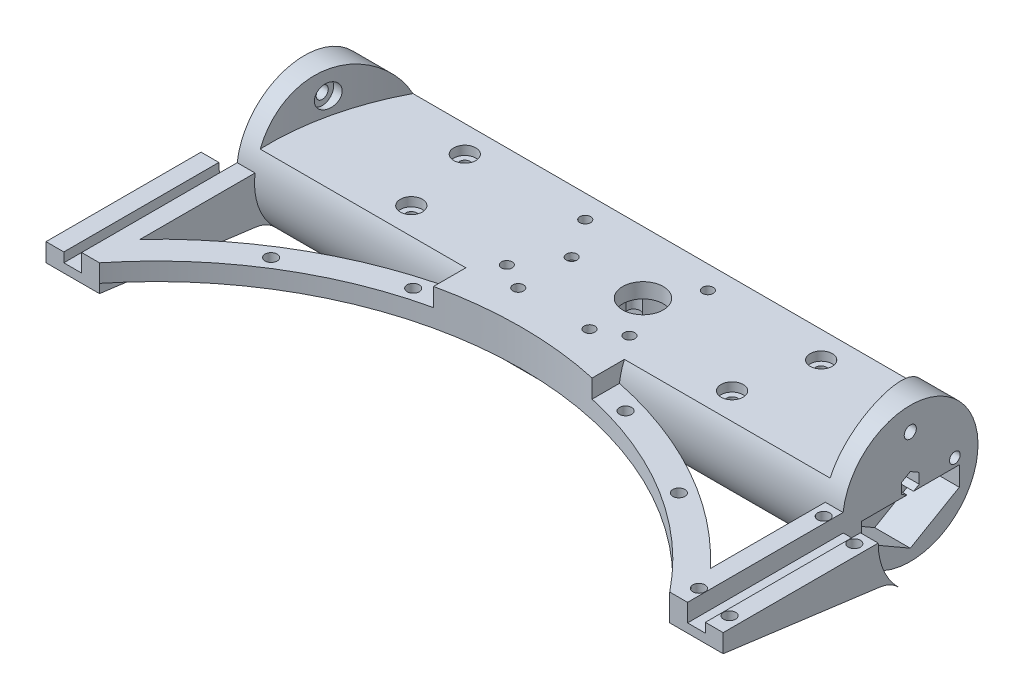
from build123d import *

# Parameters (mm, degrees)
SKETCH1_R                = 24.13
BOSS_EXTRUDE1_DEPTH      = 107.95
CUT_EXTRUDE1_DEPTH       = 12.7
BOSS_EXTRUDE2_DEPTH      = 6.35
BOSS_EXTRUDE3_START      = 12.7
BOSS_EXTRUDE3_DEPTH      = 12.7
SKETCH5_W                = 6.35
SKETCH5_H                = 6.35
CUT_EXTRUDE2_DEPTH       = 161.785460863
CUT_EXTRUDE3_DEPTH       = 147.420866085
CUT_EXTRUDE3_DEPTH_BACK  = 147.420866085
SKETCH6_W                = 165.1
SKETCH6_H                = 14.605
CAVITY1_START            = -24.1300001
CAVITY1_DEPTH            = 18.1610001
CAVITY1_START_2          = -5.969
CAVITY1_2_OUTLINE_R      = 1.143
CAVITY1_2_OUTLINE_R_2    = 4.445
CAVITY1_2_DEPTH          = 10.16
CAVITY1_START_3          = 4.191
CAVITY1_3_OUTLINE_R      = 1.143
CAVITY1_3_OUTLINE_R_2    = 7.239
CAVITY1_3_DEPTH          = 5.334
CAVITY1_4_OUTLINE_R      = 4.445
CAVITY1_4_DEPTH          = 3.048
CAVITY1_5_DEPTH          = 1.778
CAVITY1_START_4          = 6.223
CAVITY1_6_OUTLINE_R      = 1.905
CAVITY1_6_OUTLINE_R_2    = 1.143
CAVITY1_6_DEPTH          = 3.302
CAVITY1_7_OUTLINE_R      = 2.286
CAVITY1_7_DEPTH          = 1.27
CAVITY1_START_5          = 7.239
CAVITY1_8_DEPTH          = 0.254
CUT_EXTRUDE4_DEPTH       = 148.786424587
CUT_EXTRUDE4_DEPTH_BACK  = 148.786424587
SKETCH8_R                = 1.905
CUT_EXTRUDE7_DEPTH       = 31.75
SKETCH13_R               = 1.905
CUT_EXTRUDE8_DEPTH       = 12.7
SKETCH19_R               = 1.905
CUT_EXTRUDE12_DEPTH      = 9.525
CUT_EXTRUDE6_DEPTH       = 147.944540934
CUT_EXTRUDE6_DEPTH_BACK  = 147.944540934
SKETCH11_R               = 2.159
SKETCH14_R               = 1.905
CUT_EXTRUDE9_DEPTH       = 25.4
SKETCH15_R               = 3.937
CUT_EXTRUDE10_DEPTH      = 3.175
CUT_EXTRUDE13_DEPTH      = 27.305
CUT_EXTRUDE14_START      = -6.35
SKETCH21_R               = 4.064
CUT_EXTRUDE14_DEPTH      = 6.35
SKETCH22_R               = 2.159
CUT_EXTRUDE15_DEPTH      = 226.374910033
BOSS_EXTRUDE4_DEPTH      = 6.35
CUT_EXTRUDE11_DEPTH      = 147.944540934
CUT_EXTRUDE11_DEPTH_BACK = 147.944540934
SKETCH16_R               = 2.159
BOSS_EXTRUDE5_DEPTH      = 6.5278


# Read off the part's stored shape, not the designer's step: Cavity1
with BuildPart() as part:
    # Sketch1 → Boss-Extrude1 (new, symmetric)
    with BuildSketch(Plane(origin=(0, 0, 0), x_dir=(0, 0, -1), z_dir=(1, 0, 0))):
        Circle(SKETCH1_R)
    extrude(amount=BOSS_EXTRUDE1_DEPTH, both=True)

    # Sketch2 → Cut-Extrude1 (cut)
    with BuildSketch(Plane(origin=(107.95, 0, 0), x_dir=(0, 0, -1), z_dir=(1, 0, 0))):
        Polygon((-17.4625, -9.904179076), (0, -19.986158151), (17.4625, -9.904179076), (17.4625, -2.9972), (-17.4625, -2.9972), align=None)
    cut_extrude1 = extrude(amount=-CUT_EXTRUDE1_DEPTH, mode=Mode.SUBTRACT)

    # Sketch3 → Boss-Extrude2 (add)
    with BuildSketch(Plane(origin=(107.95, 0, 0), x_dir=(0, 0, -1), z_dir=(1, 0, 0))):
        with BuildLine():
            Line((-23.943134552, 2.9972), (-79.375, 2.9972))
            Line((-79.375, 2.9972), (-79.375, -6.5278))
            Line((-79.375, -6.5278), (-23.510990682, -13.882436352))
            ThreePointArc((-23.510990682, -13.882436352), (-20.024224443, -14.940135327), (-17.06248663, -17.06248663))
            ThreePointArc((-17.06248663, -17.06248663), (-22.824613886, -7.829042148), (-23.943134552, 2.9972))
        make_face()
    boss_extrude2 = extrude(amount=-BOSS_EXTRUDE2_DEPTH)

    # Sketch4 → Boss-Extrude3 (add)
    with BuildSketch(Plane(origin=(107.95, 0, 0), x_dir=(0, 0, -1), z_dir=(1, 0, 0)).offset(BOSS_EXTRUDE3_START)):
        with BuildLine():
            Line((-24.13, 0), (-79.375, 0))
            Line((-79.375, 0), (-79.375, -6.5278))
            Line((-79.375, -6.5278), (-23.510990682, -13.882436352))
            ThreePointArc((-23.510990682, -13.882436352), (-20.024224443, -14.940135327), (-17.06248663, -17.06248663))
            ThreePointArc((-17.06248663, -17.06248663), (-22.293213119, -9.234151223), (-24.13, 0))
        make_face()
    boss_extrude3 = extrude(amount=-BOSS_EXTRUDE3_DEPTH)

    # Sketch5 → Cut-Extrude2 (cut, through all)
    with BuildSketch(Plane.XY.offset(79.375)):
        with Locations((111.125, -0.1778)):
            Rectangle(SKETCH5_W, SKETCH5_H)
    cut_extrude2 = extrude(amount=-CUT_EXTRUDE2_DEPTH, mode=Mode.SUBTRACT)

    # Sketch6 → Cut-Extrude3 (cut, two sides: drawn at the far end of the back side and taken through both)
    with BuildSketch(Plane.XY.offset(-CUT_EXTRUDE3_DEPTH_BACK)):
        with Locations((0, 16.8275)):
            Rectangle(SKETCH6_W, SKETCH6_H)
    extrude(amount=CUT_EXTRUDE3_DEPTH + CUT_EXTRUDE3_DEPTH_BACK, mode=Mode.SUBTRACT)

    # Cavity1 outline → Cavity1 (cut)
    with BuildSketch(Plane(origin=(0, 0, 0), x_dir=(1, 0, 0), z_dir=(0, 1, 0)).offset(CAVITY1_START)):
        with BuildLine():
            ThreePointArc((25.654, -16.8275), (28.168471714, -15.785971714), (29.21, -13.2715))
            Line((29.21, -13.2715), (29.21, 13.2715))
            ThreePointArc((29.21, 13.2715), (28.168471714, 15.785971714), (25.654, 16.8275))
            Line((25.654, 16.8275), (-25.654, 16.8275))
            ThreePointArc((-25.654, 16.8275), (-28.168471714, 15.785971714), (-29.21, 13.2715))
            Line((-29.21, 13.2715), (-29.21, -13.2715))
            ThreePointArc((-29.21, -13.2715), (-28.168471714, -15.785971714), (-25.654, -16.8275))
            Line((-25.654, -16.8275), (25.654, -16.8275))
        make_face()
    extrude(amount=CAVITY1_DEPTH, mode=Mode.SUBTRACT)

    # Cavity1 2 outline → Cavity1 2 (cut)
    with BuildSketch(Plane(origin=(0, 0, 0), x_dir=(1, 0, 0), z_dir=(0, 1, 0)).offset(CAVITY1_START_2)):
        with BuildLine():
            ThreePointArc((25.410188518, -6.663505747), (27.051, 0), (25.410188518, 6.663505747))
            ThreePointArc((25.410188518, 6.663505747), (26.739105214, 10.236847552), (22.930567504, 10.064128852))
            ThreePointArc((22.930567504, 10.064128852), (12.7, 14.351), (2.469432496, 10.064128852))
            ThreePointArc((2.469432496, 10.064128852), (-1.339105214, 10.236847552), (-0.010188518, 6.663505747))
            ThreePointArc((-0.010188518, 6.663505747), (-1.651, 0), (-0.010188518, -6.663505747))
            ThreePointArc((-0.010188518, -6.663505747), (-1.339105214, -10.236847552), (2.469432496, -10.064128852))
            ThreePointArc((2.469432496, -10.064128852), (12.7, -14.351), (22.930567504, -10.064128852))
            ThreePointArc((22.930567504, -10.064128852), (26.739105214, -10.236847552), (25.410188518, -6.663505747))
        make_face()
        with Locations((21.844, -13.97)):
            Circle(CAVITY1_2_OUTLINE_R)
        with Locations((-21.844, -13.97)):
            Circle(CAVITY1_2_OUTLINE_R)
        with Locations((-12.7, 0)):
            Circle(CAVITY1_2_OUTLINE_R_2)
        with Locations((21.844, 13.97)):
            Circle(CAVITY1_2_OUTLINE_R)
        with Locations((-21.844, 13.97)):
            Circle(CAVITY1_2_OUTLINE_R)
    extrude(amount=CAVITY1_2_DEPTH, mode=Mode.SUBTRACT)

    # Cavity1 3 outline → Cavity1 3 (cut)
    with BuildSketch(Plane(origin=(0, 0, 0), x_dir=(1, 0, 0), z_dir=(0, 1, 0)).offset(CAVITY1_START_3)):
        with Locations((21.844, -13.97)):
            Circle(CAVITY1_3_OUTLINE_R)
        with Locations((-21.844, -13.97)):
            Circle(CAVITY1_3_OUTLINE_R)
        with Locations((21.844, 13.97)):
            Circle(CAVITY1_3_OUTLINE_R)
        with Locations((-21.844, 13.97)):
            Circle(CAVITY1_3_OUTLINE_R)
        with Locations((12.7, 0)):
            Circle(CAVITY1_3_OUTLINE_R_2)
    extrude(amount=CAVITY1_3_DEPTH, mode=Mode.SUBTRACT)

    # Cavity1 4 outline → Cavity1 4 (cut)
    with BuildSketch(Plane(origin=(0, 0, 0), x_dir=(1, 0, 0), z_dir=(0, 1, 0)).offset(CAVITY1_START_3)):
        with BuildLine():
            ThreePointArc((-1.186815, 3.62043784), (-1.651, 0), (-1.186815, -3.62043784))
            ThreePointArc((-1.186815, -3.62043784), (3.81, 0), (-1.186815, 3.62043784))
        make_face()
        with Locations((-12.7, 0)):
            Circle(CAVITY1_4_OUTLINE_R)
    extrude(amount=CAVITY1_4_DEPTH, mode=Mode.SUBTRACT)

    # Cavity1 5 outline → Cavity1 5 (cut)
    with BuildSketch(Plane(origin=(0, 0, 0), x_dir=(1, 0, 0), z_dir=(0, 1, 0)).offset(CAVITY1_START_2)):
        with BuildLine():
            Line((-11.689058668, -4.32851275), (-13.598725967, -6.269761763))
            ThreePointArc((-13.598725967, -6.269761763), (-10.20766679, -4.581043619), (-8.381648336, -1.261900971))
            Line((-8.381648336, -1.261900971), (-8.432941907, -1.245086436))
            ThreePointArc((-8.432941907, -1.245086436), (-9.643662496, -3.227510815), (-11.689058668, -4.32851275))
        make_face()
        with BuildLine():
            ThreePointArc((-20.367669641, -2.667234262), (-17.588349777, -5.605544051), (-13.598725967, -6.269761763))
            Line((-13.598725967, -6.269761763), (-11.689058668, -4.32851275))
            ThreePointArc((-11.689058668, -4.32851275), (-14.8148806, -3.909642573), (-16.876068942, -1.522653339))
            Line((-16.876068942, -1.522653339), (-20.367669641, -2.667234262))
        make_face()
        with BuildLine():
            Line((-8.432941907, -1.245086436), (-8.381648336, -1.261900971))
            ThreePointArc((-8.381648336, -1.261900971), (-8.34804351, -1.083049158), (-8.319577582, -0.903307825))
            Line((-8.319577582, -0.903307825), (-8.355488936, -0.939813075))
            ThreePointArc((-8.355488936, -0.939813075), (-8.391510846, -1.093135951), (-8.432941907, -1.245086436))
        make_face()
        with BuildLine():
            ThreePointArc((-20.367669641, 2.667234262), (-20.955, 0), (-20.367669641, -2.667234262))
            Line((-20.367669641, -2.667234262), (-16.876068942, -1.522653339))
            ThreePointArc((-16.876068942, -1.522653339), (-17.145, 0), (-16.876068942, 1.522653339))
            Line((-16.876068942, 1.522653339), (-20.367669641, 2.667234262))
        make_face()
        with BuildLine():
            Line((-8.355488936, 0.939813075), (-8.319577582, 0.903307825))
            ThreePointArc((-8.319577582, 0.903307825), (-8.34804351, 1.083049158), (-8.381648336, 1.261900971))
            Line((-8.381648336, 1.261900971), (-8.432941907, 1.245086436))
            ThreePointArc((-8.432941907, 1.245086436), (-8.391510846, 1.093135951), (-8.355488936, 0.939813075))
        make_face()
        with BuildLine():
            ThreePointArc((-8.255, 0), (-8.271164971, 0.452806607), (-8.319577582, 0.903307825))
            Line((-8.319577582, 0.903307825), (-8.355488936, 0.939813075))
            ThreePointArc((-8.355488936, 0.939813075), (-8.280193631, 0.472585083), (-8.255, 0))
        make_face()
        with BuildLine():
            Line((-8.355488936, -0.939813075), (-8.319577582, -0.903307825))
            ThreePointArc((-8.319577582, -0.903307825), (-8.271164971, -0.452806607), (-8.255, 0))
            ThreePointArc((-8.255, 0), (-8.280193631, -0.472585083), (-8.355488936, -0.939813075))
        make_face()
        with BuildLine():
            ThreePointArc((-13.598725967, 6.269761763), (-17.588349777, 5.605544051), (-20.367669641, 2.667234262))
            Line((-20.367669641, 2.667234262), (-16.876068942, 1.522653339))
            ThreePointArc((-16.876068942, 1.522653339), (-14.8148806, 3.909642573), (-11.689058668, 4.32851275))
            Line((-11.689058668, 4.32851275), (-13.598725967, 6.269761763))
        make_face()
        with BuildLine():
            Line((-8.432941907, 1.245086436), (-8.381648336, 1.261900971))
            ThreePointArc((-8.381648336, 1.261900971), (-10.20766679, 4.581043619), (-13.598725967, 6.269761763))
            Line((-13.598725967, 6.269761763), (-11.689058668, 4.32851275))
            ThreePointArc((-11.689058668, 4.32851275), (-9.643662496, 3.227510815), (-8.432941907, 1.245086436))
        make_face()
    extrude(amount=CAVITY1_5_DEPTH, mode=Mode.SUBTRACT)

    # Cavity1 6 outline → Cavity1 6 (cut)
    # profile 1 of 4: a face of its own
    with BuildSketch(Plane(origin=(0, 0, 0), x_dir=(1, 0, 0), z_dir=(0, 1, 0)).offset(CAVITY1_START_4)):
        with Locations((21.844, -13.97)):
            Circle(CAVITY1_6_OUTLINE_R)
        with Locations((21.844, -13.97)):
            Circle(CAVITY1_6_OUTLINE_R_2, mode=Mode.SUBTRACT)
    # profile 2 of 4: a face of its own
    with BuildSketch(Plane(origin=(0, 0, 0), x_dir=(1, 0, 0), z_dir=(0, 1, 0)).offset(CAVITY1_START_4)):
        with Locations((-21.844, -13.97)):
            Circle(CAVITY1_6_OUTLINE_R)
        with Locations((-21.844, -13.97)):
            Circle(CAVITY1_6_OUTLINE_R_2, mode=Mode.SUBTRACT)
    # profile 3 of 4: a face of its own
    with BuildSketch(Plane(origin=(0, 0, 0), x_dir=(1, 0, 0), z_dir=(0, 1, 0)).offset(CAVITY1_START_4)):
        with Locations((21.844, 13.97)):
            Circle(CAVITY1_6_OUTLINE_R)
        with Locations((21.844, 13.97)):
            Circle(CAVITY1_6_OUTLINE_R_2, mode=Mode.SUBTRACT)
    # profile 4 of 4: a face of its own
    with BuildSketch(Plane(origin=(0, 0, 0), x_dir=(1, 0, 0), z_dir=(0, 1, 0)).offset(CAVITY1_START_4)):
        with Locations((-21.844, 13.97)):
            Circle(CAVITY1_6_OUTLINE_R)
        with Locations((-21.844, 13.97)):
            Circle(CAVITY1_6_OUTLINE_R_2, mode=Mode.SUBTRACT)
    extrude(amount=CAVITY1_6_DEPTH, mode=Mode.SUBTRACT)

    # Cavity1 7 outline → Cavity1 7 (cut)
    with BuildSketch(Plane(origin=(0, 0, 0), x_dir=(1, 0, 0), z_dir=(0, 1, 0)).offset(CAVITY1_START_3)):
        with Locations((24.892, -8.89)):
            Circle(CAVITY1_7_OUTLINE_R)
        with Locations((0.508, -8.89)):
            Circle(CAVITY1_7_OUTLINE_R)
        with Locations((24.892, 8.89)):
            Circle(CAVITY1_7_OUTLINE_R)
        with Locations((0.508, 8.89)):
            Circle(CAVITY1_7_OUTLINE_R)
    extrude(amount=CAVITY1_7_DEPTH, mode=Mode.SUBTRACT)

    # Cavity1 8 outline → Cavity1 8 (cut)
    with BuildSketch(Plane(origin=(0, 0, 0), x_dir=(1, 0, 0), z_dir=(0, 1, 0)).offset(CAVITY1_START_5)):
        with BuildLine():
            ThreePointArc((-1.186815, 3.62043784), (-1.651, 0), (-1.186815, -3.62043784))
            ThreePointArc((-1.186815, -3.62043784), (3.81, 0), (-1.186815, 3.62043784))
        make_face()
    extrude(amount=CAVITY1_8_DEPTH, mode=Mode.SUBTRACT)

    # Sketch8 → Cut-Extrude4 (cut, two sides: drawn at the far end of the back side and taken through both)
    with BuildSketch(Plane.XZ.offset(-7.239).offset(-CUT_EXTRUDE4_DEPTH_BACK)):
        with Locations(Location((-12.7, 0, 0), (0, 0, 270))):
            Circle(SKETCH8_R)
    extrude(amount=CUT_EXTRUDE4_DEPTH + CUT_EXTRUDE4_DEPTH_BACK, mode=Mode.SUBTRACT)

    # Sketch12 → Cut-Extrude7 (cut)
    with BuildSketch(Plane(origin=(107.95, 0, 0), x_dir=(0, 0, -1), z_dir=(1, 0, 0))):
        Polygon((3.175, -1.833087105), (3.175, 1.833087105), (0, 3.666174209), (-3.175, 1.833087105), (-3.175, -1.833087105), (0, -3.666174209), align=None)
    cut_extrude7 = extrude(amount=-CUT_EXTRUDE7_DEPTH, mode=Mode.SUBTRACT)

    # Sketch13 → Cut-Extrude8 (cut)
    with BuildSketch(Plane(origin=(107.95, 0, 0), x_dir=(0, 0, -1), z_dir=(1, 0, 0))):
        with Locations((15.875, 0)):
            Circle(SKETCH13_R)
    cut_extrude8 = extrude(amount=-CUT_EXTRUDE8_DEPTH, mode=Mode.SUBTRACT)

    # Sketch19 → Cut-Extrude12 (cut)
    with BuildSketch(Plane(origin=(0, 9.525, 0), x_dir=(1, 0, 0), z_dir=(0, 1, 0))):
        with Locations(Location((12.7, -19.05, 0), (0, 0, 270))):
            Circle(SKETCH19_R)
        with Locations(Location((-12.7, -19.05, 0), (0, 0, 270))):
            Circle(SKETCH19_R)
    extrude(amount=-CUT_EXTRUDE12_DEPTH, mode=Mode.SUBTRACT)

    # Sketch11 → Cut-Extrude6 (cut, two sides: drawn at the far end of the back side and taken through both)
    with BuildSketch(Plane(origin=(0, 2.9972, 0), x_dir=(1, 0, 0), z_dir=(0, 1, 0)).offset(-CUT_EXTRUDE6_DEPTH_BACK)):
        with Locations(Location((116.586, -28.575, 0), (0, 0, 270))):
            Circle(SKETCH11_R)
        with Locations(Location((116.586, -73.025, 0), (0, 0, 270))):
            Circle(SKETCH11_R)
        with Locations(Location((105.664, -73.025, 0), (0, 0, 270))):
            Circle(SKETCH11_R)
        with Locations(Location((105.664, -28.575, 0), (0, 0, 270))):
            Circle(SKETCH11_R)
    extrude(amount=CUT_EXTRUDE6_DEPTH + CUT_EXTRUDE6_DEPTH_BACK, mode=Mode.SUBTRACT)

    # Sketch14 → Cut-Extrude9 (cut)
    with BuildSketch(Plane(origin=(0, 9.525, 0), x_dir=(1, 0, 0), z_dir=(0, 1, 0))):
        with Locations(Location((63.5, 12.7, 0), (0, 0, 270))):
            Circle(SKETCH14_R)
        with Locations(Location((57.15, -12.7, 0), (0, 0, 270))):
            Circle(SKETCH14_R)
        with Locations(Location((-57.15, -12.7, 0), (0, 0, 90))):
            Circle(SKETCH14_R)
        with Locations(Location((-63.5, 12.7, 0), (0, 0, 90))):
            Circle(SKETCH14_R)
    extrude(amount=-CUT_EXTRUDE9_DEPTH, mode=Mode.SUBTRACT)

    # Sketch15 → Cut-Extrude10 (cut)
    with BuildSketch(Plane(origin=(0, 9.525, 0), x_dir=(1, 0, 0), z_dir=(0, 1, 0))):
        with Locations(Location((63.5, 12.7, 0), (0, 0, 270))):
            Circle(SKETCH15_R)
        with Locations(Location((57.15, -12.7, 0), (0, 0, 270))):
            Circle(SKETCH15_R)
        with Locations(Location((-57.15, -12.7, 0), (0, 0, 270))):
            Circle(SKETCH15_R)
        with Locations(Location((-63.5, 12.7, 0), (0, 0, 270))):
            Circle(SKETCH15_R)
    extrude(amount=-CUT_EXTRUDE10_DEPTH, mode=Mode.SUBTRACT)

    # Sketch20 → Cut-Extrude13 (cut)
    with BuildSketch(Plane(origin=(0, 9.525, 0), x_dir=(1, 0, 0), z_dir=(0, 1, 0))):
        with BuildLine():
            Line((90.409057387, 24.13), (82.55, 24.13))
            Line((82.55, 24.13), (82.55, -24.13))
            Line((82.55, -24.13), (101.454738465, -24.13))
            ThreePointArc((101.454738465, -24.13), (99.359135308, 0.784421283), (90.409057387, 24.13))
        make_face()
    cut_extrude13 = extrude(amount=CUT_EXTRUDE13_DEPTH, mode=Mode.SUBTRACT)

    # Sketch21 → Cut-Extrude14 (cut)
    with BuildSketch(Plane(origin=(107.95, 0, 0), x_dir=(0, 0, -1), z_dir=(1, 0, 0)).offset(CUT_EXTRUDE14_START)):
        with Locations((0, 15.875)):
            Circle(SKETCH21_R)
    cut_extrude14 = extrude(amount=-CUT_EXTRUDE14_DEPTH, mode=Mode.SUBTRACT)

    # Sketch22 → Cut-Extrude15 (cut, through all)
    with BuildSketch(Plane.ZY.offset(-101.6)):
        with Locations((0, 15.875)):
            Circle(SKETCH22_R)
    cut_extrude15 = extrude(amount=-CUT_EXTRUDE15_DEPTH, mode=Mode.SUBTRACT)

    # Mirror2: Cut-Extrude1, Boss-Extrude2, Boss-Extrude3, Cut-Extrude2, Cut-Extrude7, Cut-Extrude8, Cut-Extrude13, Cut-Extrude14, Cut-Extrude15 across plane
    add(cut_extrude1.mirror(Plane(origin=(0, 0, 0), x_dir=(0, 0, 1), z_dir=(1, 0, 0))), mode=Mode.SUBTRACT)
    add(boss_extrude2.mirror(Plane(origin=(0, 0, 0), x_dir=(0, 0, 1), z_dir=(1, 0, 0))))
    add(boss_extrude3.mirror(Plane(origin=(0, 0, 0), x_dir=(0, 0, 1), z_dir=(1, 0, 0))))
    add(cut_extrude2.mirror(Plane(origin=(0, 0, 0), x_dir=(0, 0, 1), z_dir=(1, 0, 0))), mode=Mode.SUBTRACT)
    add(cut_extrude7.mirror(Plane(origin=(0, 0, 0), x_dir=(0, 0, 1), z_dir=(1, 0, 0))), mode=Mode.SUBTRACT)
    add(cut_extrude8.mirror(Plane(origin=(0, 0, 0), x_dir=(0, 0, 1), z_dir=(1, 0, 0))), mode=Mode.SUBTRACT)
    add(cut_extrude13.mirror(Plane(origin=(0, 0, 0), x_dir=(0, 0, 1), z_dir=(1, 0, 0))), mode=Mode.SUBTRACT)
    add(cut_extrude14.mirror(Plane(origin=(0, 0, 0), x_dir=(0, 0, 1), z_dir=(1, 0, 0))), mode=Mode.SUBTRACT)
    add(cut_extrude15.mirror(Plane(origin=(0, 0, 0), x_dir=(0, 0, 1), z_dir=(1, 0, 0))), mode=Mode.SUBTRACT)

    # Sketch7 → Boss-Extrude4 (add)
    with BuildSketch(Plane(origin=(0, 2.9972, 0), x_dir=(1, 0, 0), z_dir=(0, 1, 0))):
        with BuildLine():
            Line((-101.6, -79.375), (-101.6, -64.873738346))
            ThreePointArc((-101.6, -64.873738346), (0, -21.056635674), (101.6, -64.873738346))
            Line((101.6, -64.873738346), (101.6, -79.375))
            ThreePointArc((101.6, -79.375), (0, -30.581635674), (-101.6, -79.375))
        make_face()
    extrude(amount=-BOSS_EXTRUDE4_DEPTH)

    # Sketch16 → Cut-Extrude11 (cut, two sides: drawn at the far end of the back side and taken through both)
    with BuildSketch(Plane(origin=(0, 2.9972, 0), x_dir=(1, 0, 0), z_dir=(0, 1, 0)).offset(-CUT_EXTRUDE11_DEPTH_BACK)):
        with Locations(Location((72.640289503, -47.171306489, 0), (0, 0, 270))):
            Circle(SKETCH16_R)
        with Locations(Location((37.841139766, -31.349190733, 0), (0, 0, 270))):
            Circle(SKETCH16_R)
        with Locations(Location((-37.841139766, -31.349190733, 0), (0, 0, 270))):
            Circle(SKETCH16_R)
        with Locations(Location((-72.640289503, -47.171306489, 0), (0, 0, 270))):
            Circle(SKETCH16_R)
    extrude(amount=CUT_EXTRUDE11_DEPTH + CUT_EXTRUDE11_DEPTH_BACK, mode=Mode.SUBTRACT)

    # Sketch18 → Boss-Extrude5 (add)
    with BuildSketch(Plane(origin=(0, 9.525, 0), x_dir=(1, 0, 0), z_dir=(0, 1, 0))):
        with BuildLine():
            Line((28.251653237, -23.943134552), (28.251653237, -22.170504618))
            Line((28.251653237, -22.170504618), (-28.251653237, -22.170504618))
            Line((-28.251653237, -22.170504618), (-28.251653237, -23.943134552))
            Line((-28.251653237, -23.943134552), (-28.251653237, -33.684314871))
            ThreePointArc((-28.251653237, -33.684314871), (0, -30.581635674), (28.251653237, -33.684314871))
            Line((28.251653237, -33.684314871), (28.251653237, -23.943134552))
        make_face()
    extrude(amount=-BOSS_EXTRUDE5_DEPTH)


solid = part.part
